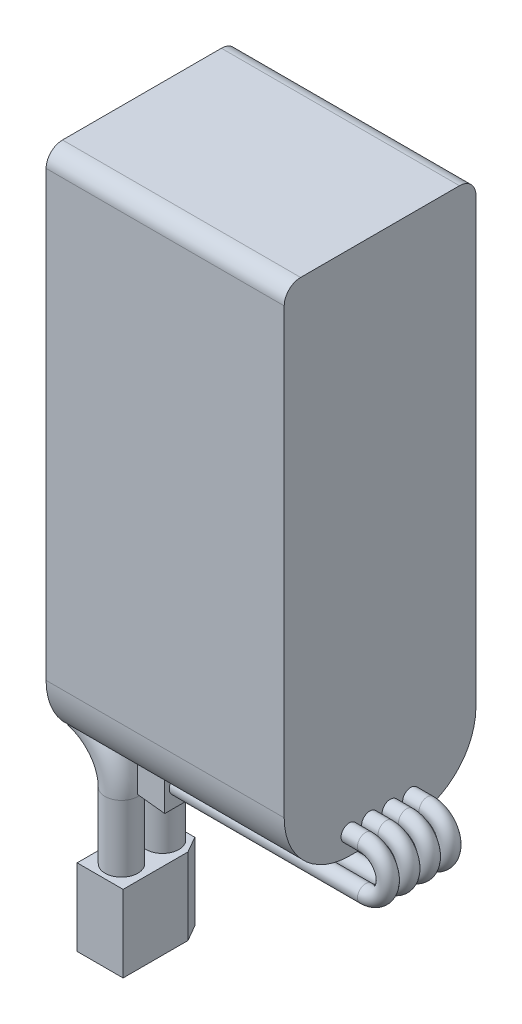
from build123d import *

# Parameters (mm, degrees)
SKETCH1_W           = 64
SKETCH1_H           = 29
BOSS_EXTRUDE1_DEPTH = 23.35
FILLET1_R           = 2
SKETCH2_R           = 2
SKETCH5_R           = 1
SKETCH7_W           = 4.6
SKETCH7_H           = 10.6
BOSS_EXTRUDE2_DEPTH = 3.5
BOSS_EXTRUDE2_TAPER = 3
BOSS_EXTRUDE3_DEPTH = 9.35
FILLET3_R           = 8


with BuildPart() as part:
    # Sketch1 → Boss-Extrude1 (new body)
    with BuildSketch(Plane(origin=(0, 0, 0), x_dir=(0, 1, 0), z_dir=(0, 0, 1))):
        Rectangle(SKETCH1_W, SKETCH1_H)
    extrude(amount=BOSS_EXTRUDE1_DEPTH)

    # Fillet1
    fillet1_edges = [part.edges().sort_by_distance(p)[0] for p in [
        (0, 32, 0),
        (0, 32, 23.35),
    ]]
    fillet(fillet1_edges, radius=FILLET1_R)

    # Sweep2: sweep along a path in Sketch4
    with BuildLine(Plane(origin=(0, 0, 0), x_dir=(0, 1, 0), z_dir=(0, 0, 1))) as sweep2_path:
        Line((-29, 14.5), (-29, 17.811482156))
        ThreePointArc((-29, 17.811482156), (-31.129819741, 20.333095361), (-33.97216907, 18.655085952))
        ThreePointArc((-33.97216907, 18.655085952), (-36.239159807, 15.640572518), (-39.83271041, 14.494739937))
        Line((-39.83271041, 14.494739937), (-47.929878258, 14.494739937))
    # Sketch2 → Sweep2 (sweep)
    with BuildSketch(Plane(origin=(-14.5, 0, 10), x_dir=(0, 0, -1), z_dir=(1, 0, 0))):
        with Locations((0.825, -29)):
            Circle(SKETCH2_R)
        with Locations((-4.175, -29)):
            Circle(SKETCH2_R)
    sweep(path=sweep2_path.line)

    # Sweep3: sweep along a path in Sketch6
    with BuildLine(Plane(origin=(0, 0, 0), x_dir=(0, 1, 0), z_dir=(0, 0, 1))) as sweep3_path:
        Line((-29.5, -14.5), (-29.5, -16.497724548))
        ThreePointArc((-29.5, -16.497724548), (-32.200025095, -19.197749643), (-34.900050191, -16.497724548))
        Line((-34.900050191, -16.497724548), (-34.900050191, 6.423160741))
    # Sketch5 → Sweep3 (sweep)
    with BuildSketch(Plane.YZ.offset(14.5)):
        with Locations((-29.5, 12.925)):
            Circle(SKETCH5_R)
        with Locations((-29.5, 10.425)):
            Circle(SKETCH5_R)
        with Locations((-29.5, 15.425)):
            Circle(SKETCH5_R)
        with Locations((-29.5, 7.925)):
            Circle(SKETCH5_R)
    sweep(path=sweep3_path.line)

    # Sketch7 → Boss-Extrude2 (add)
    with BuildSketch(Plane(origin=(-6.423160741, 0, 0), x_dir=(0, -1, 0), z_dir=(-1, 0, 0))):
        with Locations((34.900050191, 11.675)):
            Rectangle(SKETCH7_W, SKETCH7_H)
    extrude(amount=BOSS_EXTRUDE2_DEPTH, taper=BOSS_EXTRUDE2_TAPER)

    # Sketch8 → Boss-Extrude3 (add)
    with BuildSketch(Plane.XZ.offset(47.929878258)):
        Polygon((-16.35310297, 6.911630097), (-12.828061558, 6.911630097), (-11.694739937, 8.874600725), (-11.694739937, 16.775), (-17.294739937, 16.775), (-17.294739937, 8.542593166), align=None)
    extrude(amount=BOSS_EXTRUDE3_DEPTH)

    # Fillet3
    fillet3_edges = [part.edges().sort_by_distance(p)[0] for p in [
        (0, -32, 0),
        (0, -32, 23.35),
    ]]
    fillet(fillet3_edges, radius=FILLET3_R)


solid = part.part
